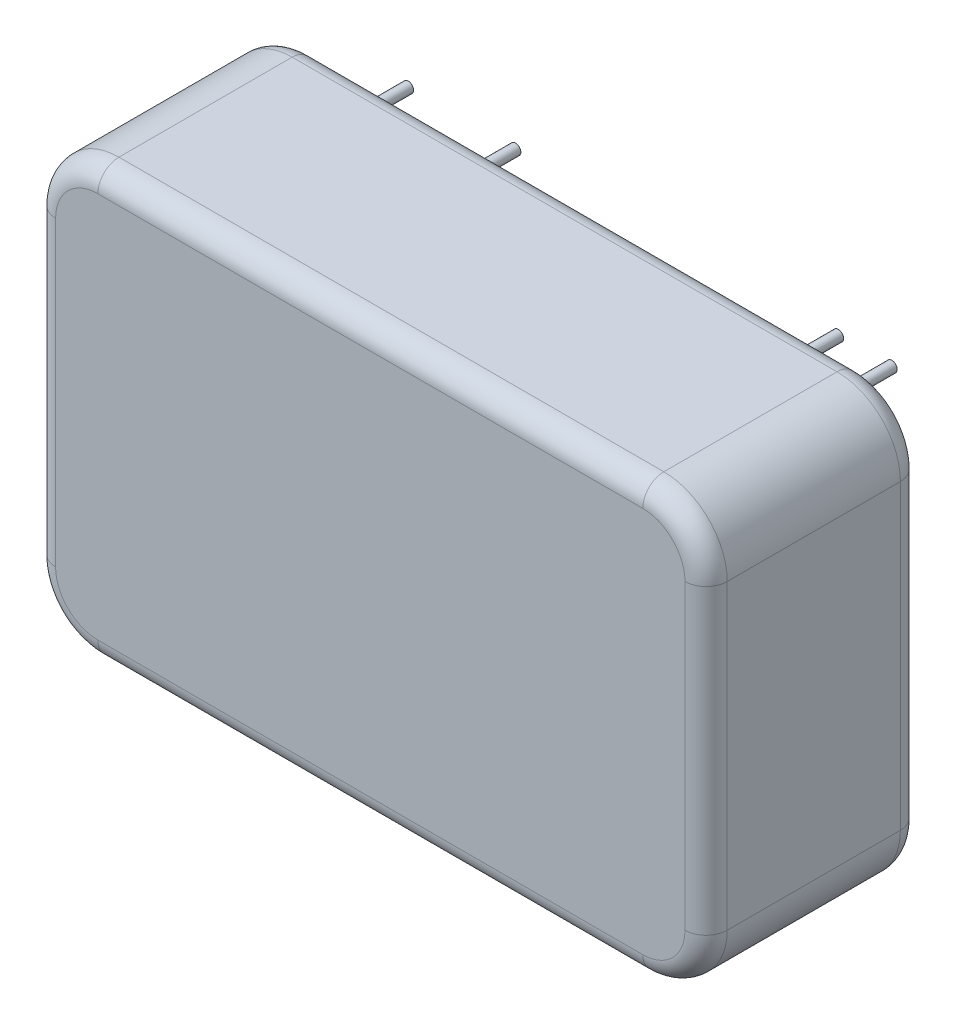
from build123d import *

# Parameters (mm, degrees)
SKETCH_1_W      = 31.8
SKETCH_1_H      = 20.3
EXTRUDE_1_DEPTH = 10.2
FILLET_2_R      = 1
FILLET_1_R      = 3
SKETCH_2_R      = 0.25
EXTRUDE_2_DEPTH = 3.05


with BuildPart() as part:
    # Эскиз1 → Бобышка-Вытянуть1 (new body)
    with BuildSketch(Plane.XY):
        Rectangle(SKETCH_1_W, SKETCH_1_H)
    extrude(amount=EXTRUDE_1_DEPTH)

    # Скругление2
    fillet_2_edges = [part.edges().sort_by_distance(p)[0] for p in [
        (-15.9, 0, 10.2),
        (0, -10.15, 10.2),
        (15.9, 0, 10.2),
        (0, -10.15, 0),
        (-15.9, 0, 0),
        (0, 10.15, 0),
        (15.9, 0, 0),
        (0, 10.15, 10.2),
    ]]
    fillet(fillet_2_edges, radius=FILLET_2_R)

    # Скругление1
    # the kernel refuses this fillet: 3 mm, written as the material it takes off along each edge
    with BuildSketch(Plane(origin=(12.9, -7.15, 0), x_dir=(1, 0, 0), z_dir=(0, 1, 0))) as fillet_1_piece_1:
        with BuildLine():
            CenterArc((2, -1), 1, 0, 90)
            Line((3, -1), (3, 0))
            Line((3, 0), (2, 0))
        make_face()
    revolve(axis=Axis((12.9, -7.15, 0), (0, 0, -1)), revolution_arc=90, mode=Mode.SUBTRACT)
    with BuildSketch(Plane(origin=(-12.9, -7.15, 0), x_dir=(0, -1, 0), z_dir=(1, 0, 0))) as fillet_1_piece_2:
        with BuildLine():
            CenterArc((2, -1), 1, 0, 90)
            Line((3, -1), (3, 0))
            Line((3, 0), (2, 0))
        make_face()
    revolve(axis=Axis((-12.9, -7.15, 0), (0, 0, -1)), revolution_arc=90, mode=Mode.SUBTRACT)
    with BuildSketch(Plane(origin=(12.9, 7.15, 0), x_dir=(0, 1, 0), z_dir=(-1, 0, 0))) as fillet_1_piece_3:
        with BuildLine():
            CenterArc((2, -1), 1, 0, 90)
            Line((3, -1), (3, 0))
            Line((3, 0), (2, 0))
        make_face()
    revolve(axis=Axis((12.9, 7.15, 0), (0, 0, -1)), revolution_arc=90, mode=Mode.SUBTRACT)
    with BuildSketch(Plane(origin=(-12.9, 7.15, 0), x_dir=(-1, 0, 0), z_dir=(0, -1, 0))) as fillet_1_piece_4:
        with BuildLine():
            CenterArc((2, -1), 1, 0, 90)
            Line((3, -1), (3, 0))
            Line((3, 0), (2, 0))
        make_face()
    revolve(axis=Axis((-12.9, 7.15, 0), (0, 0, -1)), revolution_arc=90, mode=Mode.SUBTRACT)
    with BuildSketch(Plane(origin=(12.9, -7.15, 10.2), x_dir=(0, -1, 0), z_dir=(-1, 0, 0))) as fillet_1_piece_5:
        with BuildLine():
            CenterArc((2, -1), 1, 0, 90)
            Line((3, -1), (3, 0))
            Line((3, 0), (2, 0))
        make_face()
    revolve(axis=Axis((12.9, -7.15, 10.2), (0, 0, 1)), revolution_arc=90, mode=Mode.SUBTRACT)
    with BuildSketch(Plane(origin=(-12.9, -7.15, 10.2), x_dir=(-1, 0, 0), z_dir=(0, 1, 0))) as fillet_1_piece_6:
        with BuildLine():
            CenterArc((2, -1), 1, 0, 90)
            Line((3, -1), (3, 0))
            Line((3, 0), (2, 0))
        make_face()
    revolve(axis=Axis((-12.9, -7.15, 10.2), (0, 0, 1)), revolution_arc=90, mode=Mode.SUBTRACT)
    with BuildSketch(Plane(origin=(12.9, 7.15, 10.2), x_dir=(1, 0, 0), z_dir=(0, -1, 0))) as fillet_1_piece_7:
        with BuildLine():
            CenterArc((2, -1), 1, 0, 90)
            Line((3, -1), (3, 0))
            Line((3, 0), (2, 0))
        make_face()
    revolve(axis=Axis((12.9, 7.15, 10.2), (0, 0, 1)), revolution_arc=90, mode=Mode.SUBTRACT)
    with BuildSketch(Plane(origin=(-12.9, 7.15, 10.2), x_dir=(0, 1, 0), z_dir=(1, 0, 0))) as fillet_1_piece_8:
        with BuildLine():
            CenterArc((2, -1), 1, 0, 90)
            Line((3, -1), (3, 0))
            Line((3, 0), (2, 0))
        make_face()
    revolve(axis=Axis((-12.9, 7.15, 10.2), (0, 0, 1)), revolution_arc=90, mode=Mode.SUBTRACT)
    with BuildSketch(Plane(origin=(-15.9, 10.15, 0), x_dir=(0, -1, 0), z_dir=(0, 0, 1)), Plane(origin=(-15.9, -10.15, 0), x_dir=(1, 0, 0), z_dir=(0, 0, 1))) as fillet_1_piece_9:
        with BuildLine():
            CenterArc((FILLET_1_R, FILLET_1_R), FILLET_1_R, 180, 90)
            Line((0, FILLET_1_R), (0, 0))
            Line((0, 0), (FILLET_1_R, 0))
        make_face()
    extrude(amount=10.2, mode=Mode.SUBTRACT)
    with BuildSketch(Plane(origin=(15.9, 10.15, 0), x_dir=(0, -1, 0), z_dir=(0, 0, 1)), Plane(origin=(15.9, -10.15, 0), x_dir=(-1, 0, 0), z_dir=(0, 0, 1))) as fillet_1_piece_10:
        with BuildLine():
            CenterArc((FILLET_1_R, -FILLET_1_R), FILLET_1_R, 90, 90)
            Line((0, -FILLET_1_R), (0, 0))
            Line((0, 0), (FILLET_1_R, 0))
        make_face()
    extrude(amount=10.2, mode=Mode.SUBTRACT)

    # Эскиз2 → Бобышка-Вытянуть2 (add)
    with BuildSketch(Plane(origin=(0, 0, 0), x_dir=(-1, 0, 0), z_dir=(0, 0, -1))):
        with Locations((11.45, 7.62)):
            Circle(SKETCH_2_R)
        with Locations((6.37, 7.62)):
            Circle(SKETCH_2_R)
        with Locations((-8.91, 7.62)):
            Circle(SKETCH_2_R)
        with Locations((-11.45, 7.62)):
            Circle(SKETCH_2_R)
        with Locations((-11.45, -7.62)):
            Circle(SKETCH_2_R)
        with Locations((-8.91, -7.62)):
            Circle(SKETCH_2_R)
        with Locations((6.37, -7.62)):
            Circle(SKETCH_2_R)
        with Locations((11.45, -7.62)):
            Circle(SKETCH_2_R)
    extrude(amount=EXTRUDE_2_DEPTH)


solid = part.part
